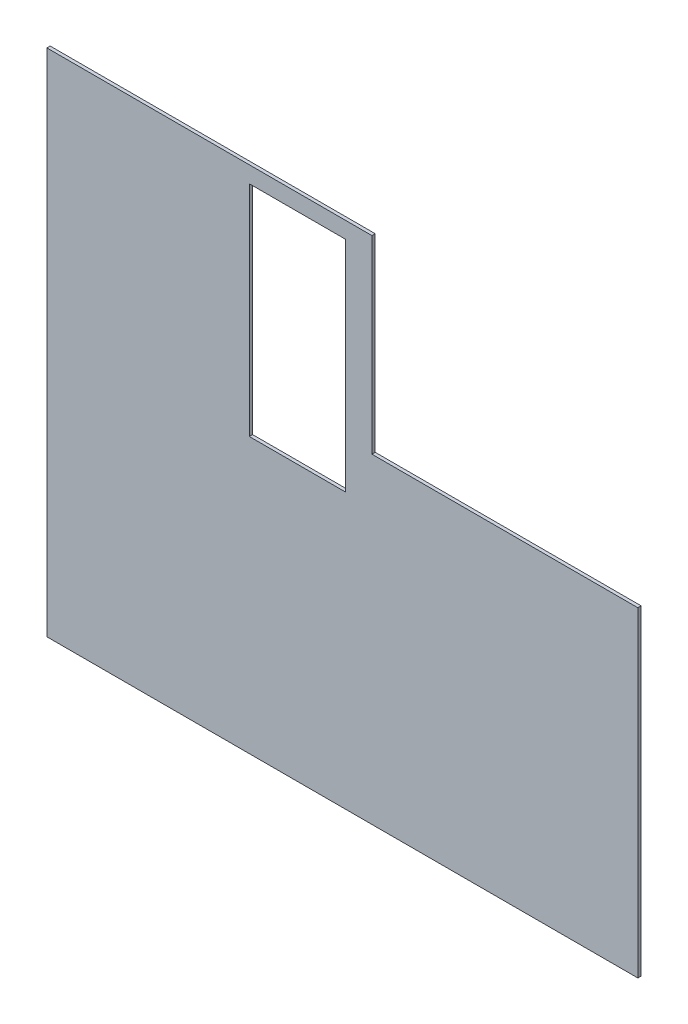
from build123d import *

# Parameters (mm, degrees)
ESQUISSE1_W        = 88
ESQUISSE1_H        = 200
BOSS_EXTRU_1_DEPTH = 3


with BuildPart() as part:
    # Esquisse1 → Boss.-Extru.1 (new body)
    with BuildSketch(Plane.XY):
        Polygon((589.223057321, -367.643778293), (49.223057321, -367.643778293), (49.223057321, 98.356221707), (346.223057321, 98.356221707), (346.223057321, -74.643778293), (589.223057321, -74.643778293), align=None)
        with Locations((278.223057321, -16.643778293)):
            Rectangle(ESQUISSE1_W, ESQUISSE1_H, mode=Mode.SUBTRACT)
    extrude(amount=BOSS_EXTRU_1_DEPTH)


solid = part.part
